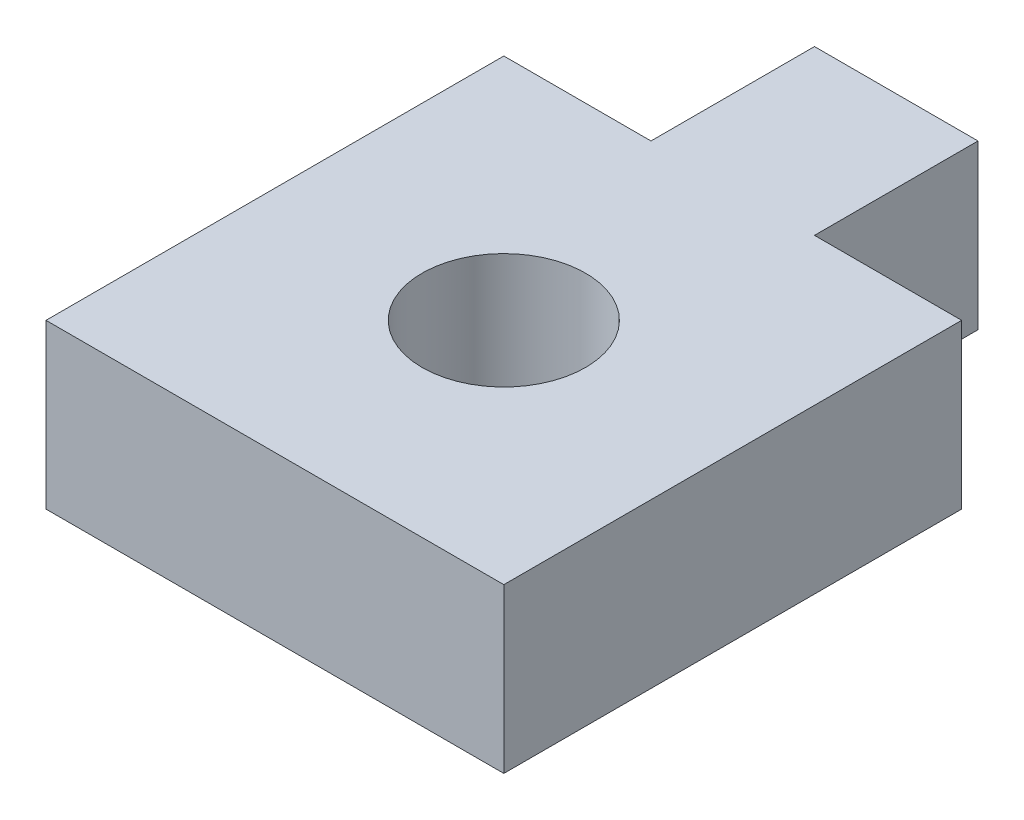
from build123d import *

# Parameters (mm, degrees)
SKETCH1_R           = 3.175
BOSS_EXTRUDE1_DEPTH = 6.35


with BuildPart() as part:
    # Sketch1 → Boss-Extrude1 (new body)
    with BuildSketch(Plane(origin=(0, 0, 0), x_dir=(1, 0, 0), z_dir=(0, 1, 0))):
        Polygon((0, 0), (0, 17.78), (-5.715, 17.78), (-5.715, 24.13), (-12.065, 24.13), (-12.065, 17.78), (-17.78, 17.78), (-17.78, 0), align=None)
        with Locations((-8.89, 8.89)):
            Circle(SKETCH1_R, mode=Mode.SUBTRACT)
    extrude(amount=BOSS_EXTRUDE1_DEPTH)


solid = part.part
